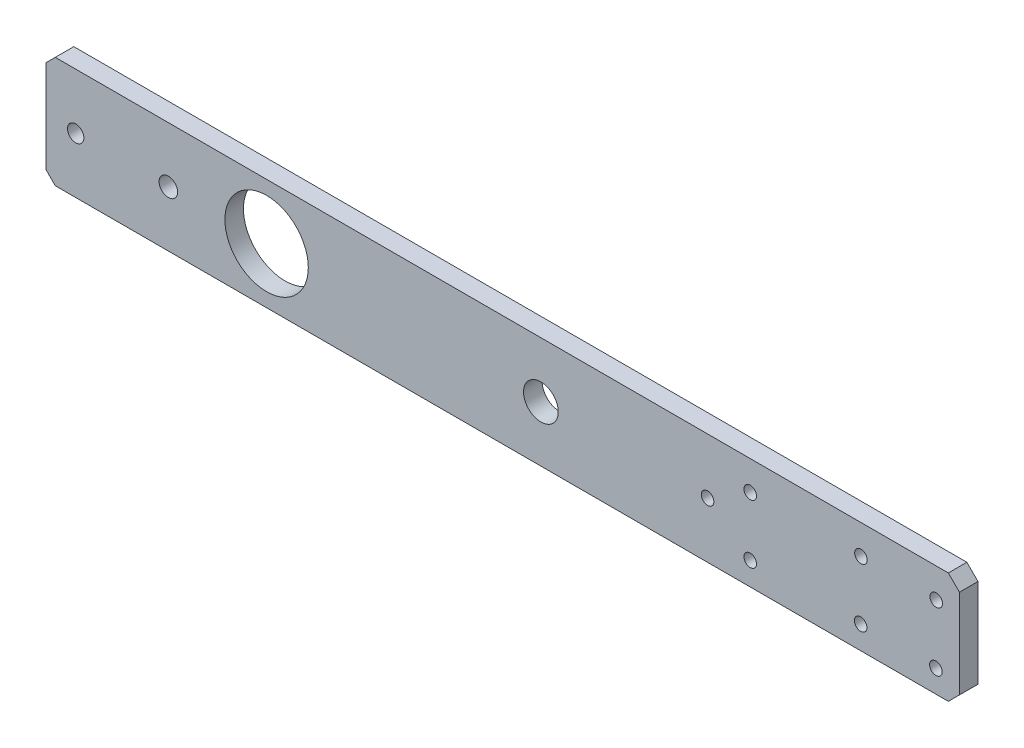
from build123d import *
from build123d.topology import SkipClean

# Parameters (mm, degrees)
SKETCH1_R                                          = 14.2875
BOSS_EXTRUDE1_DEPTH                                = 3.175
F_6_CLEARANCE_HOLE3_D                              = 4.3053
CUT_EXTRUDE1_DEPTH                                 = 255.792513626
CHAMFER1_SIZE                                      = 3.81
SKETCH10_W                                         = 50.8
SKETCH10_H                                         = 38.1
BOSS_EXTRUDE2_DEPTH                                = 6.35
CHAMFER2_SIZE                                      = 3.175
CSK_FOR_10_FLAT_HEAD_MACHINE_SCREW_100_D           = 5.6134
CSK_FOR_10_FLAT_HEAD_MACHINE_SCREW_100_CSINK_D     = 9.779
CSK_FOR_10_FLAT_HEAD_MACHINE_SCREW_100_CSINK_ANGLE = 100
F_1_4_0_25_DIAMETER_HOLE1_D                        = 6.35
CSK_FOR_6_FLAT_HEAD_MACHINE_SCREW_100_D            = 4.3053
CSK_FOR_6_FLAT_HEAD_MACHINE_SCREW_100_CSINK_D      = 7.0866
CSK_FOR_6_FLAT_HEAD_MACHINE_SCREW_100_CSINK_ANGLE  = 100
F_15_32_0_46875_DIAMETER_HOLE1_D                   = 11.90625


# Read off the part's stored shape, not the designer's step: DeleteFace1
with BuildPart() as part:
    # Sketch1 → Boss-Extrude1 (new, symmetric)
    with BuildSketch(Plane.XY):
        Polygon((0, 19.05), (-28.575, 19.05), (-28.575, -19.05), (0, -19.05), (247.281942035, -19.05), (254, 19.05), align=None)
        Circle(SKETCH1_R, mode=Mode.SUBTRACT)
    extrude(amount=BOSS_EXTRUDE1_DEPTH, both=True)

    # #6 Clearance Hole3 (through all)
    with Locations(Plane.XY.offset(3.175)):
        with Locations((229.388701471, 8.923791784), (229.282371239, -11.346798968), (203.503161764, -11.143926969), (203.608782335, 8.991375351), (165.672159691, 8.991375351), (165.672159691, -11.143926969), (151.067159691, 0)):
            Hole(F_6_CLEARANCE_HOLE3_D / 2)

    # Sketch9 → Cut-Extrude1 (cut, through all)
    with BuildSketch(Plane.XY.offset(3.175)):
        Polygon((254, 19.05), (247.281942035, -19.05), (237.352085197, -19.05), (237.352085197, 19.05), align=None)
    extrude(amount=-CUT_EXTRUDE1_DEPTH, mode=Mode.SUBTRACT)

    # Chamfer1
    chamfer1_edges = [part.edges().sort_by_distance(p)[0] for p in [
        (-28.575, -19.05, 0),
        (-28.575, 19.05, 0),
        (237.352085197, 19.05, 0),
        (237.352085197, -19.05, 0),
    ]]
    chamfer(chamfer1_edges, length=CHAMFER1_SIZE)

    # Sketch10 → Boss-Extrude2 (add, through all)
    with BuildSketch(Plane.XY.offset(3.175)):
        with Locations((-50.165, 0)):
            Rectangle(SKETCH10_W, SKETCH10_H)
    extrude(amount=-BOSS_EXTRUDE2_DEPTH)

    # Chamfer2
    chamfer2_edges = [part.edges().sort_by_distance(p)[0] for p in [
        (-75.565, -19.05, 0),
        (-75.565, 19.05, 0),
    ]]
    chamfer(chamfer2_edges, length=CHAMFER2_SIZE)

    # CSK for #10 Flat Head Machine Screw (100)1 (through all)
    with Locations(Plane.XY.offset(3.175)):
        with Locations((-65.405, 0)):
            CounterSinkHole(CSK_FOR_10_FLAT_HEAD_MACHINE_SCREW_100_D / 2, CSK_FOR_10_FLAT_HEAD_MACHINE_SCREW_100_CSINK_D / 2, counter_sink_angle=CSK_FOR_10_FLAT_HEAD_MACHINE_SCREW_100_CSINK_ANGLE)

    # 1/4 (0.25) Diameter Hole1 (through all)
    with Locations(Plane.XY.offset(3.175)):
        with Locations((-33.655, 0)):
            Hole(F_1_4_0_25_DIAMETER_HOLE1_D / 2)

    # CSK for #6 Flat Head Machine Screw (100)1 (through all)
    with Locations(Plane(origin=(0, 0, -3.175), x_dir=(-1, 0, 0), z_dir=(0, 0, -1))):
        with Locations((-151.067159691, 0), (-165.672159691, -11.143926969), (-165.672159691, 8.991375351)):
            CounterSinkHole(CSK_FOR_6_FLAT_HEAD_MACHINE_SCREW_100_D / 2, CSK_FOR_6_FLAT_HEAD_MACHINE_SCREW_100_CSINK_D / 2, counter_sink_angle=CSK_FOR_6_FLAT_HEAD_MACHINE_SCREW_100_CSINK_ANGLE)

    # 15/32 (0.46875) Diameter Hole1 (through all)
    with Locations(Plane(origin=(0, 0, -3.175), x_dir=(-1, 0, 0), z_dir=(0, 0, -1))):
        with Locations((-93.967218212, 0)):
            Hole(F_15_32_0_46875_DIAMETER_HOLE1_D / 2)

    # DeleteFace1 outline → DeleteFace1 (revolve)
    with SkipClean():  # the faces are left unmerged after this step: merging them gives an invalid solid
        with BuildSketch(Plane(origin=(-65.405, 0, 0), x_dir=(1, 0, 0), z_dir=(0, -1, 0))):
            Polygon((2.8067, 3.175), (2.8067, 1.427323288), (4.8895, 3.175), align=None)
        revolve(axis=Axis((-65.405, 0, 0), (0, 0, 1)))
    add(part.part.scale(1), mode=Mode.REPLACE)  # the faces are merged on a copy

    # DeleteFace1 2 outline → DeleteFace1 2 (revolve)
    with BuildSketch(Plane(origin=(165.672159691, 8.991375351, 0), x_dir=(1, 0, 0), z_dir=(0, -1, 0))):
        Polygon((3.5433, -3.175), (2.15265, -2.008106098), (2.15265, -3.175), align=None)
    revolve(axis=Axis((165.672159691, 8.991375351, 0), (0, 0, 1)))

    # DeleteFace1 3 outline → DeleteFace1 3 (revolve)
    with BuildSketch(Plane(origin=(165.672159691, -11.143926969, 0), x_dir=(1, 0, 0), z_dir=(0, -1, 0))):
        Polygon((3.5433, -3.175), (2.15265, -2.008106098), (2.15265, -3.175), align=None)
    revolve(axis=Axis((165.672159691, -11.143926969, 0), (0, 0, 1)))

    # DeleteFace1 4 outline → DeleteFace1 4 (revolve)
    with BuildSketch(Plane(origin=(151.067159691, 0, 0), x_dir=(1, 0, 0), z_dir=(0, -1, 0))):
        Polygon((3.5433, -3.175), (2.15265, -2.008106098), (2.15265, -3.175), align=None)
    revolve(axis=Axis((151.067159691, 0, 0), (0, 0, 1)))


solid = part.part
